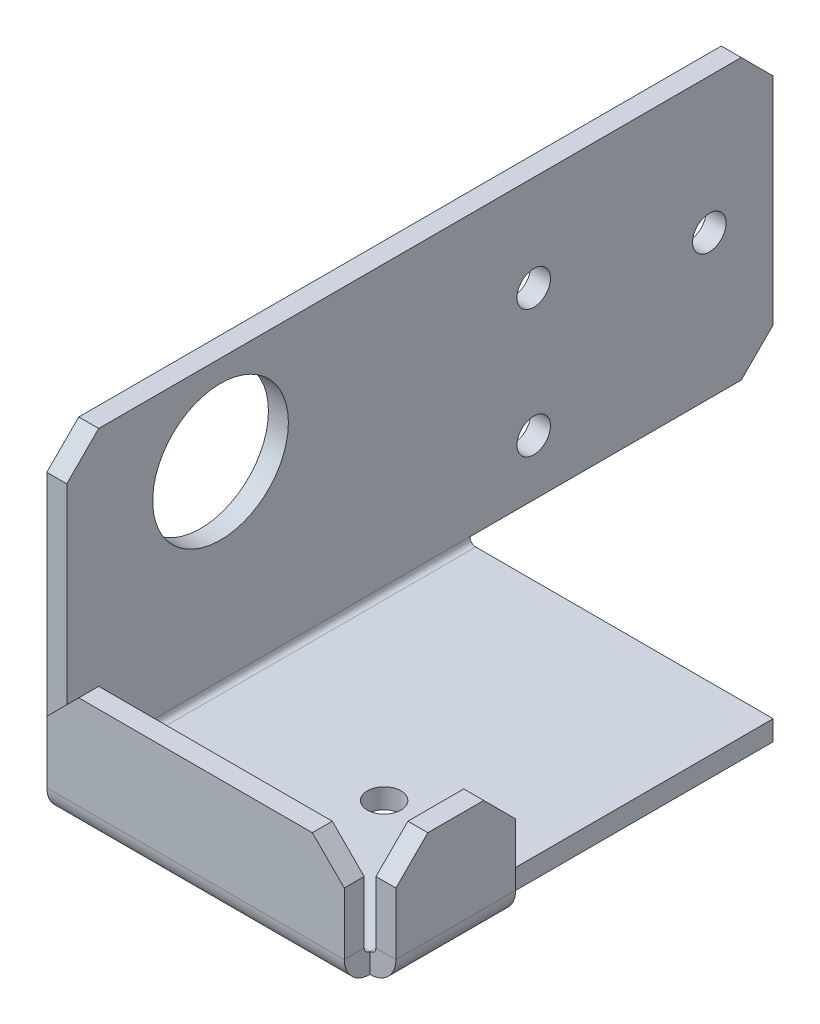
from build123d import *

# Parameters (mm, degrees)
SKETCH1_R               = 2.1
BASE_FLANGE1_DEPTH      = 2.5
EDGE_FLANGE1_DEPTH      = 50.5
EDGE_FLANGE2_DEPTH      = 15
EDGE_FLANGE2_START      = 2.5
EDGE_FLANGE2_FLAT_DEPTH = 2.5
EDGE_FLANGE3_DEPTH      = 37.2634
CUT_EXTRUDE1_DEPTH      = 103.451505402
SKETCH18_R              = 8.5
CUT_EXTRUDE2_DEPTH      = 66.845913762
SKETCH19_R              = 2.1
CUT_EXTRUDE3_DEPTH      = 73.336290606


# Sheet-metal steps are written as plain solids
with BuildPart() as part:
    # Sketch1 → Base-Flange1 (new body)
    with BuildSketch(Plane(origin=(0, 0, 0), x_dir=(0, 0, -1), z_dir=(1, 0, 0))):
        Polygon((40.25, 19.5), (44.25, 15.5), (44.25, -11.5), (40.25, -15.5), (-44.25, -15.5), (-44.25, 15.5), (-40.25, 19.5), align=None)
        with Locations((14.25, 7.5)):
            Circle(SKETCH1_R, mode=Mode.SUBTRACT)
        with Locations((14.25, -8.5)):
            Circle(SKETCH1_R, mode=Mode.SUBTRACT)
        with Locations((36.25, 2.5)):
            Circle(SKETCH1_R, mode=Mode.SUBTRACT)
    extrude(amount=-BASE_FLANGE1_DEPTH)

    # Edge-Flange1 section (across the edge) → Edge-Flange1 (add)
    with BuildSketch(Plane(origin=(0, -16.2366, 44.25), x_dir=(0, 1, 0), z_dir=(0, 0, -1))):
        with BuildLine():
            Line((-2.5, 0.7366), (-2.5, 38))
            Line((-2.5, 38), (0, 38))
            Line((0, 38), (0, 0.7366))
            ThreePointArc((0, 0.7366), (0.215745145, 0.215745145), (0.7366, 0))
            Line((0.7366, 0), (0.7366, -2.5))
            ThreePointArc((0.7366, -2.5), (-1.552021808, -1.552021808), (-2.5, 0.7366))
        make_face()
    extrude(amount=EDGE_FLANGE1_DEPTH)

    # Edge-Flange2 bend section (across the edge) → Edge-Flange2 (add)
    with BuildSketch(Plane(origin=(38.7366, -16.2366, 44.25), x_dir=(-1, 0, 0), z_dir=(0, 0, -1))):
        with BuildLine():
            Line((-2.5, 0.7366), (0, 0.7366))
            ThreePointArc((0, 0.7366), (0.215745145, 0.215745145), (0.7366, 0))
            Line((0.7366, 0), (0.7366, -2.5))
            ThreePointArc((0.7366, -2.5), (-1.552021808, -1.552021808), (-2.5, 0.7366))
        make_face()
    extrude(amount=EDGE_FLANGE2_DEPTH)

    # Edge-Flange2 profile (on flange) → Edge-Flange2 flat (add)
    with BuildSketch(Plane(origin=(38.7366, -16.2366, 0), x_dir=(0, 0, -1), z_dir=(1, 0, 0)).offset(EDGE_FLANGE2_START)):
        Polygon((-44.25, 0.7366), (-29.25, 0.7366), (-29.25, 8.5), (-33.25, 12.5), (-40.25, 12.5), (-44.25, 8.5), align=None)
    extrude(amount=-EDGE_FLANGE2_FLAT_DEPTH)

    # Edge-Flange3 section (across the edge) → Edge-Flange3 (add)
    with BuildSketch(Plane(origin=(0.7366, -16.2366, 44.9866), x_dir=(0, 0, -1), z_dir=(1, 0, 0))):
        with BuildLine():
            Line((-2.5, 0.7366), (-2.5, 12.5))
            Line((-2.5, 12.5), (0, 12.5))
            Line((0, 12.5), (0, 0.7366))
            ThreePointArc((0, 0.7366), (0.215745145, 0.215745145), (0.7366, 0))
            Line((0.7366, 0), (0.7366, -2.5))
            ThreePointArc((0.7366, -2.5), (-1.552021808, -1.552021808), (-2.5, 0.7366))
        make_face()
    extrude(amount=EDGE_FLANGE3_DEPTH)

    # Sketch17 → Cut-Extrude1 (cut, through all)
    with BuildSketch(Plane.XY.offset(47.4866)):
        Polygon((0.7366, -7.7366), (4.7366, -3.7366), (0.7366, -3.7366), align=None)
        Polygon((34, -3.7366), (38, -7.7366), (38, -3.7366), align=None)
    extrude(amount=-CUT_EXTRUDE1_DEPTH, mode=Mode.SUBTRACT)

    # Sketch18 → Cut-Extrude2 (cut, through all)
    with BuildSketch(Plane(origin=(0, 0, 0), x_dir=(0, 0, -1), z_dir=(1, 0, 0))):
        with Locations((-24.9866, 8.2634)):
            Circle(SKETCH18_R)
    extrude(amount=-CUT_EXTRUDE2_DEPTH, mode=Mode.SUBTRACT)

    # Sketch19 → Cut-Extrude3 (cut, through all)
    with BuildSketch(Plane(origin=(0, -16.2366, 0), x_dir=(1, 0, 0), z_dir=(0, 1, 0))):
        with Locations(Location((22.5, -26.9866, 0), (0, 0, 180))):
            Circle(SKETCH19_R)
    extrude(amount=-CUT_EXTRUDE3_DEPTH, mode=Mode.SUBTRACT)


solid = part.part
